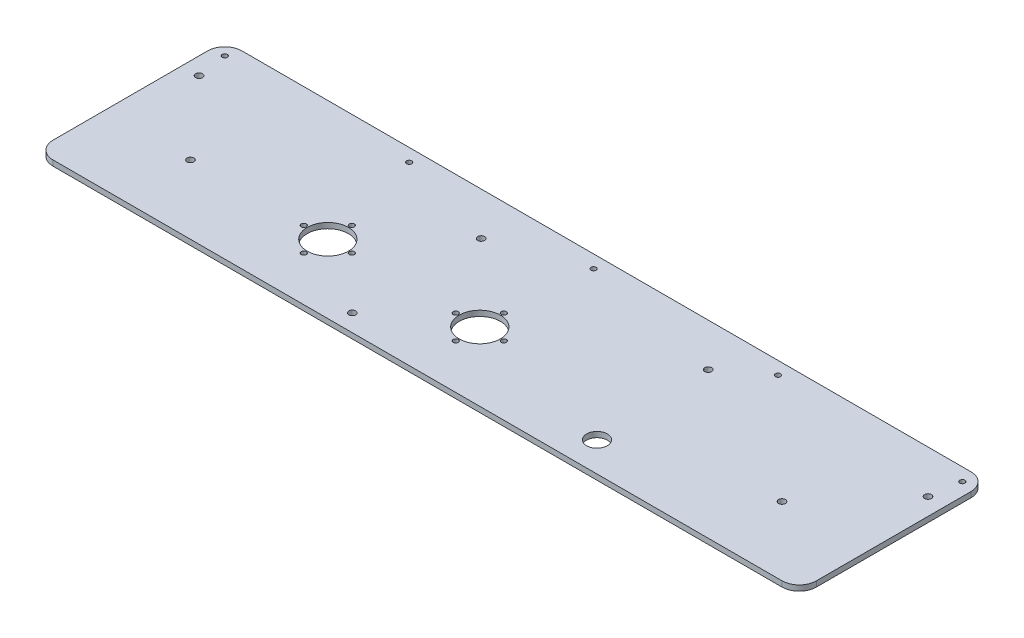
from build123d import *

# Parameters (mm, degrees)
SKETCH1_R           = 2
SKETCH1_R_2         = 1.5
SKETCH1_R_3         = 6
SKETCH1_R_4         = 12
BOSS_EXTRUDE1_DEPTH = 3.175
FILLET1_R           = 10


with BuildPart() as part:
    # Sketch1 → Boss-Extrude1 (new body)
    with BuildSketch(Plane(origin=(0, 0, 0), x_dir=(1, 0, 0), z_dir=(0, 1, 0))):
        Polygon((-26.799577535, 0), (417.700422465, 0), (417.700422465, 17.22815868), (417.700422465, 110), (-26.799577535, 110), align=None)
        with Locations((23.200422465, 40)):
            Circle(SKETCH1_R, mode=Mode.SUBTRACT)
        with Locations((89.200422465, 40)):
            Circle(SKETCH1_R_2, mode=Mode.SUBTRACT)
        with Locations((103.200422465, 26)):
            Circle(SKETCH1_R_2, mode=Mode.SUBTRACT)
        with Locations((117.200422465, 40)):
            Circle(SKETCH1_R_2, mode=Mode.SUBTRACT)
        with Locations((177.700422465, 40)):
            Circle(SKETCH1_R_2, mode=Mode.SUBTRACT)
        with Locations((191.700422465, 26)):
            Circle(SKETCH1_R_2, mode=Mode.SUBTRACT)
        with Locations((205.700422465, 40)):
            Circle(SKETCH1_R_2, mode=Mode.SUBTRACT)
        with Locations((367.700422465, 40)):
            Circle(SKETCH1_R, mode=Mode.SUBTRACT)
        with Locations((147.450422465, 10)):
            Circle(SKETCH1_R, mode=Mode.SUBTRACT)
        with Locations((282.700422465, 17.22815868)):
            Circle(SKETCH1_R_3, mode=Mode.SUBTRACT)
        with Locations((-16.799577535, 85)):
            Circle(SKETCH1_R, mode=Mode.SUBTRACT)
        with Locations((147.450422465, 85)):
            Circle(SKETCH1_R, mode=Mode.SUBTRACT)
        with Locations((103.200422465, 54)):
            Circle(SKETCH1_R_2, mode=Mode.SUBTRACT)
        with Locations((103.200422465, 40)):
            Circle(SKETCH1_R_4, mode=Mode.SUBTRACT)
        with Locations((279.700422465, 85)):
            Circle(SKETCH1_R, mode=Mode.SUBTRACT)
        with Locations((191.700422465, 54)):
            Circle(SKETCH1_R_2, mode=Mode.SUBTRACT)
        with Locations((191.700422465, 40)):
            Circle(SKETCH1_R_4, mode=Mode.SUBTRACT)
        with Locations((407.700422465, 85)):
            Circle(SKETCH1_R, mode=Mode.SUBTRACT)
        with Locations((-19.299577535, 102.5)):
            Circle(SKETCH1_R_2, mode=Mode.SUBTRACT)
        with Locations((88.075422465, 102.5)):
            Circle(SKETCH1_R_2, mode=Mode.SUBTRACT)
        with Locations((195.450422465, 102.5)):
            Circle(SKETCH1_R_2, mode=Mode.SUBTRACT)
        with Locations((302.825422465, 102.5)):
            Circle(SKETCH1_R_2, mode=Mode.SUBTRACT)
        with Locations((410.200422465, 102.5)):
            Circle(SKETCH1_R_2, mode=Mode.SUBTRACT)
    extrude(amount=BOSS_EXTRUDE1_DEPTH)

    # Fillet1
    fillet1_edges = [part.edges().sort_by_distance(p)[0] for p in [
        (417.700422465, 1.5875, -110),
        (417.700422465, 1.5875, 0),
        (-26.799577535, 1.5875, 0),
        (-26.799577535, 1.5875, -110),
    ]]
    fillet(fillet1_edges, radius=FILLET1_R)


solid = part.part
